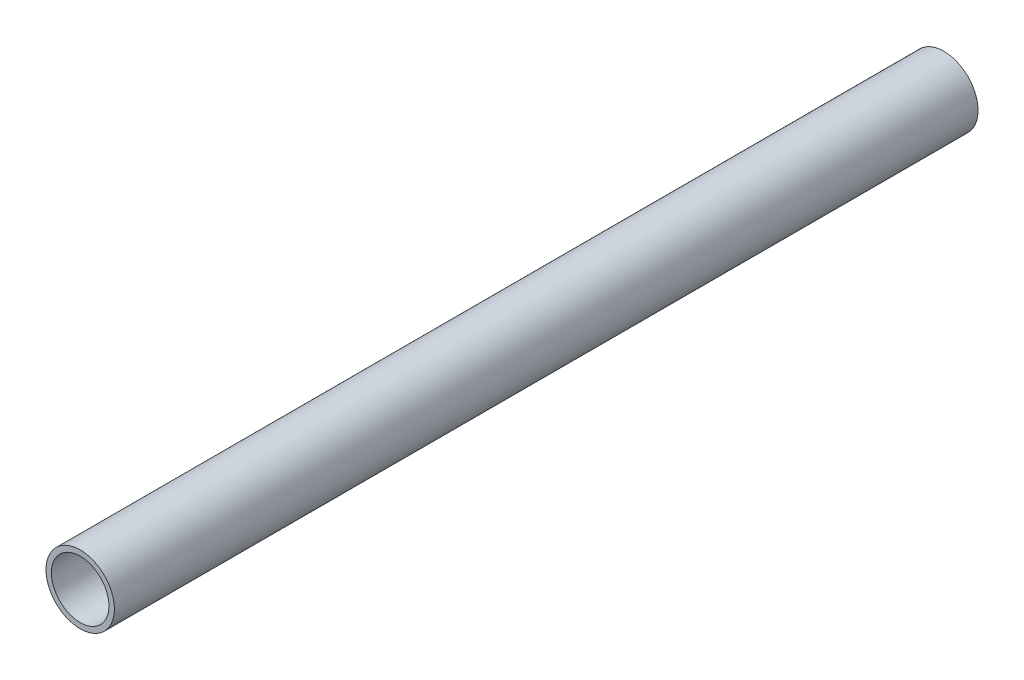
from build123d import *

# Parameters (mm, degrees)
SKETCH1_R           = 24.13
SKETCH1_R_2         = 20.32
BOSS_EXTRUDE1_DEPTH = 609.6


with BuildPart() as part:
    # Sketch1 → Boss-Extrude1 (new body)
    with BuildSketch(Plane.XY):
        Circle(SKETCH1_R)
        Circle(SKETCH1_R_2, mode=Mode.SUBTRACT)
    extrude(amount=BOSS_EXTRUDE1_DEPTH)


solid = part.part
